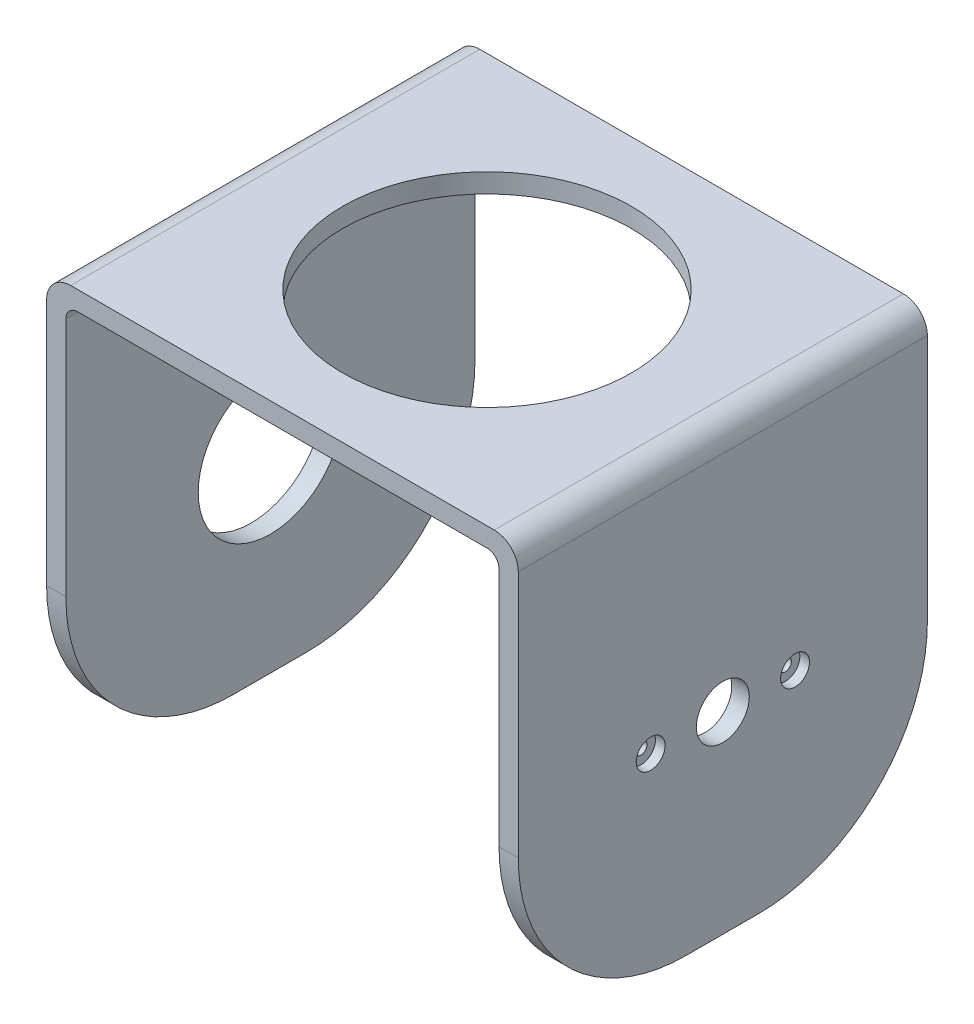
from build123d import *

# Parameters (mm, degrees)
EXTRUDE_1_DEPTH          = 170
CUT_EXTRUDE_1_DEPTH      = 180
CUT_EXTRUDE_2_DEPTH      = 313.955268369
CUT_EXTRUDE_2_DEPTH_BACK = 313.955268369
SKETCH_3_R               = 11
FILLET_1_R               = 70
FILLET_2_R               = 5
FILLET_3_R               = 10
SKETCH_6_R               = 30
CUT_EXTRUDE_6_DEPTH      = 39
SKETCH_7_R               = 13
CUT_EXTRUDE_7_DEPTH      = 0.7
SKETCH_8_R               = 2.5
CUT_EXTRUDE_8_DEPTH      = 10
SKETCH_9_R               = 6
CUT_EXTRUDE_9_DEPTH      = 4


with BuildPart() as part:
    # 草图1 → 凸台-拉伸1 (new body)
    with BuildSketch(Plane.XY):
        Polygon((-180, 0), (0, 0), (0, -175), (8, -175), (8, 8), (-180, 8), (-188, 8), (-188, -175), (-180, -175), align=None)
    extrude(amount=EXTRUDE_1_DEPTH)

    # 草图2 → 切除-拉伸1 (cut)
    with BuildSketch(Plane(origin=(0, 8, 0), x_dir=(1, 0, 0), z_dir=(0, 1, 0))):
        with BuildLine():
            ThreePointArc((-30, -85), (-90, -25), (-150, -85))
            Line((-150, -85), (-30, -85))
        make_face()
        with BuildLine():
            Line((-30, -85), (-150, -85))
            ThreePointArc((-150, -85), (-90, -145), (-30, -85))
        make_face()
        with BuildLine():
            ThreePointArc((-30, -85), (-90, -25), (-150, -85))
            Line((-150, -85), (-30, -85))
        make_face()
        with BuildLine():
            Line((-30, -85), (-150, -85))
            ThreePointArc((-150, -85), (-90, -145), (-30, -85))
        make_face()
    extrude(amount=-CUT_EXTRUDE_1_DEPTH, mode=Mode.SUBTRACT)

    # 草图3 → 切除-拉伸2 (cut, two sides: drawn at the far end of the back side and taken through both)
    with BuildSketch(Plane(origin=(8, 0, 0), x_dir=(0, 0, -1), z_dir=(1, 0, 0)).offset(-CUT_EXTRUDE_2_DEPTH_BACK)):
        with Locations((-85, -95)):
            Circle(SKETCH_3_R)
    extrude(amount=CUT_EXTRUDE_2_DEPTH + CUT_EXTRUDE_2_DEPTH_BACK, mode=Mode.SUBTRACT)

    # 圆角1
    fillet_1_edges = [part.edges().sort_by_distance(p)[0] for p in [
        (-184, -175, 170),
        (-184, -175, 0),
        (4, -175, 0),
        (4, -175, 170),
    ]]
    fillet(fillet_1_edges, radius=FILLET_1_R)

    # 圆角2
    fillet_2_edges = [part.edges().sort_by_distance(p)[0] for p in [
        (-180, 0, 85),
        (0, 0, 85),
    ]]
    fillet(fillet_2_edges, radius=FILLET_2_R)

    # 圆角3
    fillet_3_edges = [part.edges().sort_by_distance(p)[0] for p in [
        (8, 8, 85),
        (-188, 8, 85),
    ]]
    fillet(fillet_3_edges, radius=FILLET_3_R)

    # 草图6 → 切除-拉伸6 (cut)
    with BuildSketch(Plane.ZY.offset(188)):
        with Locations((85, -95)):
            Circle(SKETCH_6_R)
    extrude(amount=-CUT_EXTRUDE_6_DEPTH, mode=Mode.SUBTRACT)

    # 草图7 → 切除-拉伸7 (cut)
    with BuildSketch(Plane.ZY):
        with Locations((85, -95)):
            Circle(SKETCH_7_R)
    extrude(amount=-CUT_EXTRUDE_7_DEPTH, mode=Mode.SUBTRACT)

    # 草图8 → 切除-拉伸8 (cut)
    with BuildSketch(Plane(origin=(8, 0, 0), x_dir=(0, 0, -1), z_dir=(1, 0, 0))):
        with Locations((-55, -95)):
            Circle(SKETCH_8_R)
        with Locations((-115, -95)):
            Circle(SKETCH_8_R)
    extrude(amount=-CUT_EXTRUDE_8_DEPTH, mode=Mode.SUBTRACT)

    # 草图9 → 切除-拉伸9 (cut)
    with BuildSketch(Plane(origin=(8, 0, 0), x_dir=(0, 0, -1), z_dir=(1, 0, 0))):
        with Locations((-55, -95)):
            Circle(SKETCH_9_R)
        with Locations((-115, -95)):
            Circle(SKETCH_9_R)
    extrude(amount=-CUT_EXTRUDE_9_DEPTH, mode=Mode.SUBTRACT)


solid = part.part
